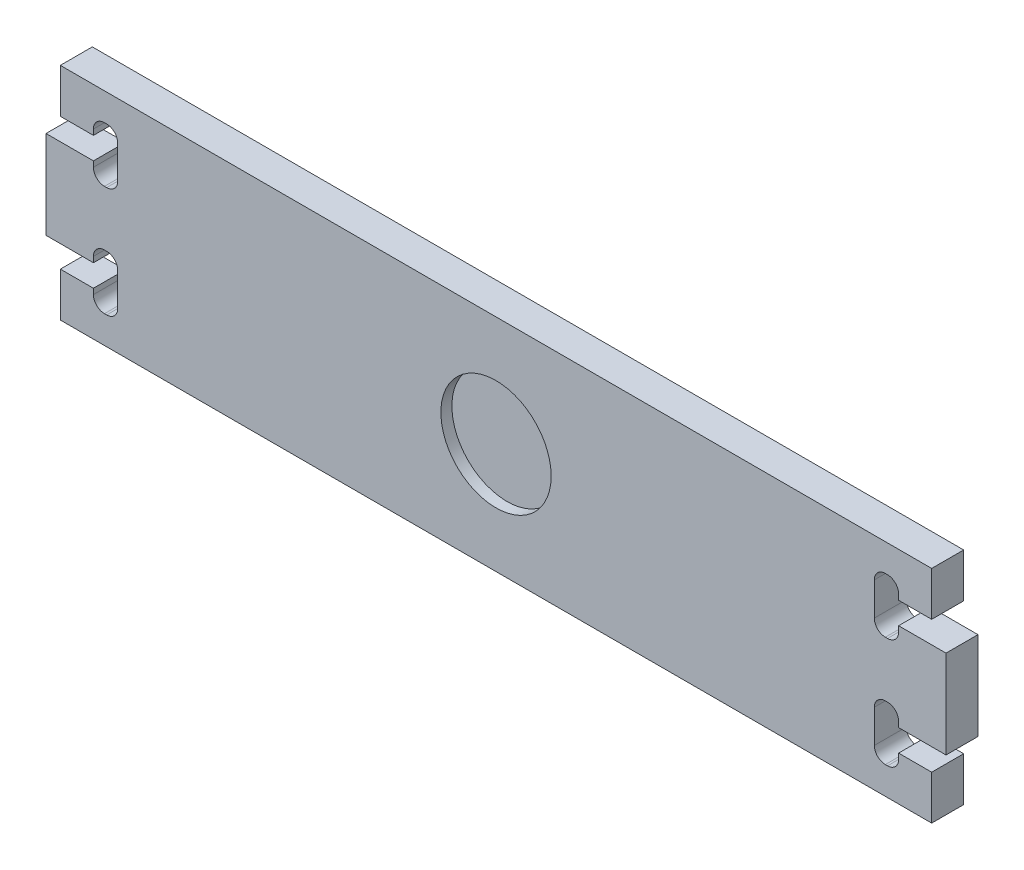
from build123d import *

# Parameters (mm, degrees)
BASE_SHAPE_DEPTH       = 2.9
SKETCH2_R              = 5
FORWARD_CUT_TEMP_DEPTH = 1
FILLET1_R              = 1


with BuildPart() as part:
    # Sketch1 → Base shape (new body)
    with BuildSketch(Plane.XY):
        Polygon((39.5, 10), (-39.5, 10), (-39.5, 6), (-36.5, 6), (-36.5, 7.5), (-34.3, 7.5), (-34.3, 2.5), (-36.5, 2.5), (-36.5, 4), (-40.8, 4), (-40.8, -4), (-36.5, -4), (-36.5, -2.5), (-34.3, -2.5), (-34.3, -7.5), (-36.5, -7.5), (-36.5, -6), (-39.5, -6), (-39.5, -10), (39.5, -10), (39.5, -6), (36.5, -6), (36.5, -7.5), (34.3, -7.5), (34.3, -2.5), (36.5, -2.5), (36.5, -4), (40.8, -4), (40.8, 4), (36.5, 4), (36.5, 2.5), (34.3, 2.5), (34.3, 7.5), (36.5, 7.5), (36.5, 6), (39.5, 6), align=None)
    extrude(amount=BASE_SHAPE_DEPTH)

    # Sketch2 → Forward cut (temp) (cut)
    with BuildSketch(Plane.XY.offset(2.9)):
        Circle(SKETCH2_R)
    extrude(amount=-FORWARD_CUT_TEMP_DEPTH, mode=Mode.SUBTRACT)

    # Fillet1
    fillet1_edges = [part.edges().sort_by_distance(p)[0] for p in [
        (36.5, -7.5, 1.45),
        (36.5, 2.5, 1.45),
        (34.3, 2.5, 1.45),
        (34.3, -7.5, 1.45),
        (36.5, -2.5, 1.45),
        (36.5, 7.5, 1.45),
        (34.3, -2.5, 1.45),
        (34.3, 7.5, 1.45),
        (-36.5, -2.5, 1.45),
        (-34.3, -2.5, 1.45),
        (-34.3, -7.5, 1.45),
        (-36.5, -7.5, 1.45),
        (-36.5, 2.5, 1.45),
        (-34.3, 2.5, 1.45),
        (-34.3, 7.5, 1.45),
        (-36.5, 7.5, 1.45),
    ]]
    fillet(fillet1_edges, radius=FILLET1_R)


solid = part.part
